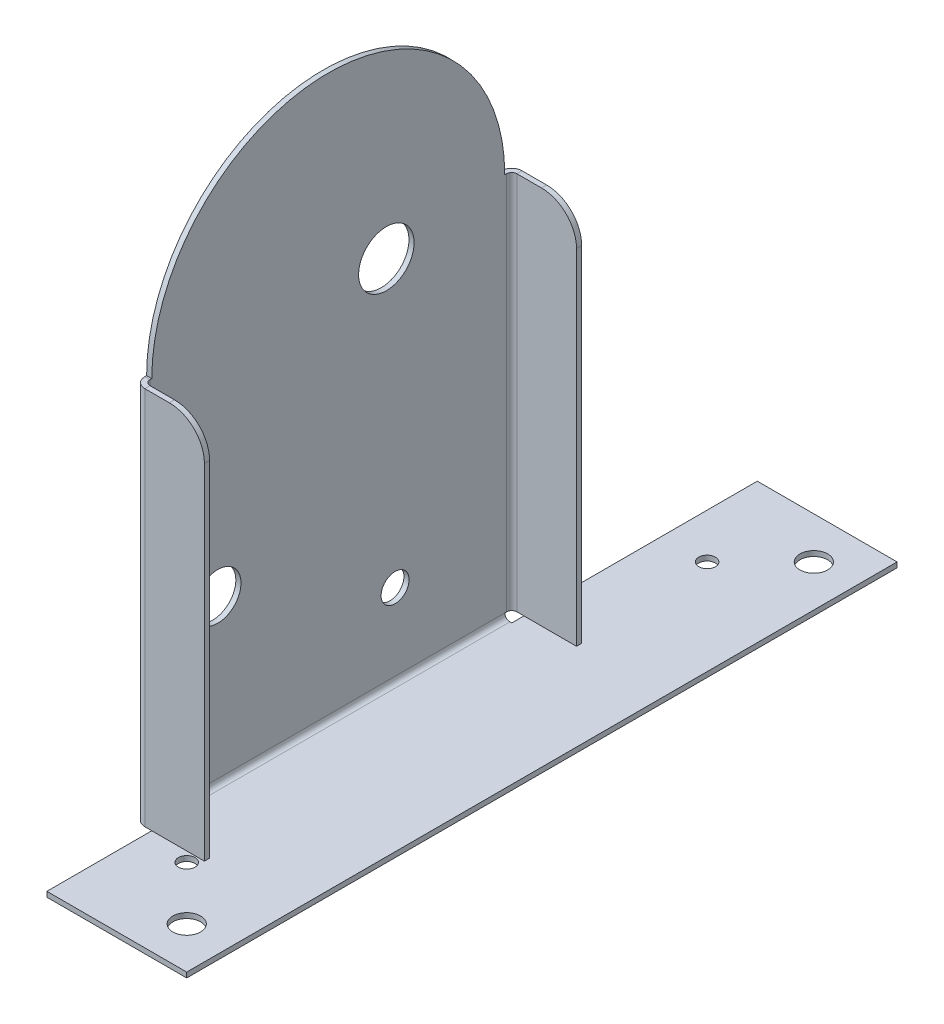
from build123d import *

# Parameters (mm, degrees)
SKETCH1_W                 = 20
SKETCH1_H                 = 101.6
BASE_FLANGE1_DEPTH        = 0.7366
EDGE_FLANGE1_DEPTH        = 50.486713846
EDGE_FLANGE1_START        = 0.7366
EDGE_FLANGE1_FLAT_DEPTH   = 0.7366
CUT_EXTRUDE1_DEPTH        = 245.392554313
CUT_EXTRUDE1_DEPTH_BACK   = 245.392554313
SKETCH9_R                 = 2
CUT_EXTRUDE3_DEPTH        = 248.026355859
CUT_EXTRUDE3_DEPTH_BACK   = 248.026355859
SKETCH11_R                = 3.96875
CUT_EXTRUDE5_DEPTH        = 199.550344579
CUT_EXTRUDE5_DEPTH_BACK   = 199.550344579
SKETCH13_R                = 1.984375
SKETCH13_R_2              = 1.190625
EDGE_FLANGE2_DEPTH        = 54.2634
EDGE_FLANGE2_START        = 0.7366
EDGE_FLANGE2_FLAT_DEPTH   = 0.7366
EDGE_FLANGE2_BEND_DEPTH   = 54.2634
EDGE_FLANGE2_FLAT_2_DEPTH = 0.7366
CUT_EXTRUDE35_DEPTH       = 251.457429571
CUT_EXTRUDE35_DEPTH_BACK  = 251.457429571
SKETCH50_R                = 3.325000001


# Sheet-metal steps are written as plain solids
with BuildPart() as part:
    # Sketch1 → Base-Flange1 (new body)
    with BuildSketch(Plane(origin=(0, 0, 0), x_dir=(1, 0, 0), z_dir=(0, 1, 0))):
        Rectangle(SKETCH1_W, SKETCH1_H)
    extrude(amount=-BASE_FLANGE1_DEPTH)

    # Edge-Flange1 bend section (across the edge) → Edge-Flange1 (add)
    with BuildSketch(Plane(origin=(-11, 0, -15.686713846), x_dir=(1, 0, 0), z_dir=(0, 0, 1))):
        with BuildLine():
            Line((-0.7366, 0.7366), (0, 0.7366))
            ThreePointArc((0, 0.7366), (0.215745145, 0.215745145), (0.7366, 0))
            Line((0.7366, 0), (1, 0))
            Line((1, 0), (1, -0.7366))
            Line((1, -0.7366), (0.7366, -0.7366))
            ThreePointArc((0.7366, -0.7366), (-0.30510971, -0.30510971), (-0.7366, 0.7366))
        make_face()
    extrude(amount=EDGE_FLANGE1_DEPTH)

    # Edge-Flange1 profile (on flange) → Edge-Flange1 flat (add)
    with BuildSketch(Plane.ZY.offset(11).offset(EDGE_FLANGE1_START)):
        with BuildLine():
            ThreePointArc((34.8, 55), (9.556643077, 80.243356923), (-15.686713846, 55))
            Line((-15.686713846, 55), (-15.686713846, 0.7366))
            Line((-15.686713846, 0.7366), (34.8, 0.7366))
            Line((34.8, 0.7366), (34.8, 55))
        make_face()
    extrude(amount=-EDGE_FLANGE1_FLAT_DEPTH)

    # Sketch9 → Cut-Extrude1 (cut, two sides: drawn at the far end of the back side and taken through both)
    with BuildSketch(Plane(origin=(-48.111610167, -124.793980752, 68.826299478), x_dir=(0, 0, -1), z_dir=(1, 0, 0)).offset(-CUT_EXTRUDE1_DEPTH_BACK)):
        with Locations(Location((68.826299478, 136.507533033, 0), (0, 0, 270))):
            Circle(SKETCH9_R)
    extrude(amount=CUT_EXTRUDE1_DEPTH + CUT_EXTRUDE1_DEPTH_BACK, mode=Mode.SUBTRACT)

    # Sketch11 → Cut-Extrude3 (cut, two sides: drawn at the far end of the back side and taken through both)
    with BuildSketch(Plane(origin=(-58.346610167, -124.793980752, 68.826299478), x_dir=(0, 0, -1), z_dir=(1, 0, 0)).offset(-CUT_EXTRUDE3_DEPTH_BACK)):
        with Locations(Location((67.576820433, 177.878571709, 0), (0, 0, 270))):
            Circle(SKETCH11_R)
    extrude(amount=CUT_EXTRUDE3_DEPTH + CUT_EXTRUDE3_DEPTH_BACK, mode=Mode.SUBTRACT)

    # Sketch13 → Cut-Extrude5 (cut, two sides: drawn at the far end of the back side and taken through both)
    with BuildSketch(Plane(origin=(124.911822879, 0, 68.826299478), x_dir=(-0.7071067811865436, 0, 0.7071067811865515), z_dir=(0, 1, 0)).offset(-CUT_EXTRUDE5_DEPTH_BACK)):
        with Locations(Location((68.508410595, -102.424928038, 0), (0, 0, 45))):
            Circle(SKETCH13_R)
        with Locations(Location((68.508410595, -113.219195896, 0), (0, 0, 45))):
            Circle(SKETCH13_R_2)
        with Locations(Location((5.089841868, -165.843496765, 0), (0, 0, 45))):
            Circle(SKETCH13_R)
        with Locations(Location((15.884109726, -165.843496765, 0), (0, 0, 45))):
            Circle(SKETCH13_R_2)
    extrude(amount=CUT_EXTRUDE5_DEPTH + CUT_EXTRUDE5_DEPTH_BACK, mode=Mode.SUBTRACT)

    # Edge-Flange2 bend section (across the edge) → Edge-Flange2 (add)
    with BuildSketch(Plane(origin=(-11, 0.7366, -16.686713846), x_dir=(0, 0, 1), z_dir=(0, 1, 0))):
        with BuildLine():
            Line((-0.7366, 0.7366), (0, 0.7366))
            ThreePointArc((0, 0.7366), (0.215745145, 0.215745145), (0.7366, 0))
            Line((0.7366, 0), (1, 0))
            Line((1, 0), (1, -0.7366))
            Line((1, -0.7366), (0.7366, -0.7366))
            ThreePointArc((0.7366, -0.7366), (-0.30510971, -0.30510971), (-0.7366, 0.7366))
        make_face()
    extrude(amount=EDGE_FLANGE2_DEPTH)

    # Edge-Flange2 profile (on flange) → Edge-Flange2 flat (add)
    with BuildSketch(Plane(origin=(-11, 0, -16.686713846), x_dir=(0, 1, 0), z_dir=(0, 0, -1)).offset(EDGE_FLANGE2_START)):
        with BuildLine():
            Line((50, 9.2634), (0.7366, 9.2634))
            Line((0.7366, 9.2634), (0.7366, 0.7366))
            Line((0.7366, 0.7366), (55, 0.7366))
            Line((55, 0.7366), (55, 4.2634))
            ThreePointArc((55, 4.2634), (53.535533906, 7.798933906), (50, 9.2634))
        make_face()
    extrude(amount=-EDGE_FLANGE2_FLAT_DEPTH)

    # Edge-Flange2 bend section 2 (across the edge) → Edge-Flange2 bend (add)
    with BuildSketch(Plane(origin=(-11, 55, 35.8), x_dir=(0, 0, -1), z_dir=(0, -1, 0))):
        with BuildLine():
            Line((-0.7366, 0.7366), (0, 0.7366))
            ThreePointArc((0, 0.7366), (0.215745145, 0.215745145), (0.7366, 0))
            Line((0.7366, 0), (1, 0))
            Line((1, 0), (1, -0.7366))
            Line((1, -0.7366), (0.7366, -0.7366))
            ThreePointArc((0.7366, -0.7366), (-0.30510971, -0.30510971), (-0.7366, 0.7366))
        make_face()
    extrude(amount=EDGE_FLANGE2_BEND_DEPTH)

    # Edge-Flange2 profile 2 (on flange) → Edge-Flange2 flat 2 (add)
    with BuildSketch(Plane(origin=(-11, 0, 35.8), x_dir=(0, -1, 0), z_dir=(0, 0, 1)).offset(EDGE_FLANGE2_START)):
        with BuildLine():
            ThreePointArc((-50, 9.2634), (-53.535533906, 7.798933906), (-55, 4.2634))
            Line((-55, 4.2634), (-55, 0.7366))
            Line((-55, 0.7366), (-0.7366, 0.7366))
            Line((-0.7366, 0.7366), (-0.7366, 9.2634))
            Line((-0.7366, 9.2634), (-50, 9.2634))
        make_face()
    extrude(amount=-EDGE_FLANGE2_FLAT_2_DEPTH)

    # Sketch50 → Cut-Extrude35 (cut, two sides: drawn at the far end of the back side and taken through both)
    with BuildSketch(Plane(origin=(-69.8634, -124.793980752, 68.826299478), x_dir=(0, 0, -1), z_dir=(1, 0, 0)).offset(-CUT_EXTRUDE35_DEPTH_BACK)):
        with Locations(Location((43.461576529, 148.105383059, 0), (0, 0, 270))):
            Circle(SKETCH50_R)
    extrude(amount=CUT_EXTRUDE35_DEPTH + CUT_EXTRUDE35_DEPTH_BACK, mode=Mode.SUBTRACT)


solid = part.part
